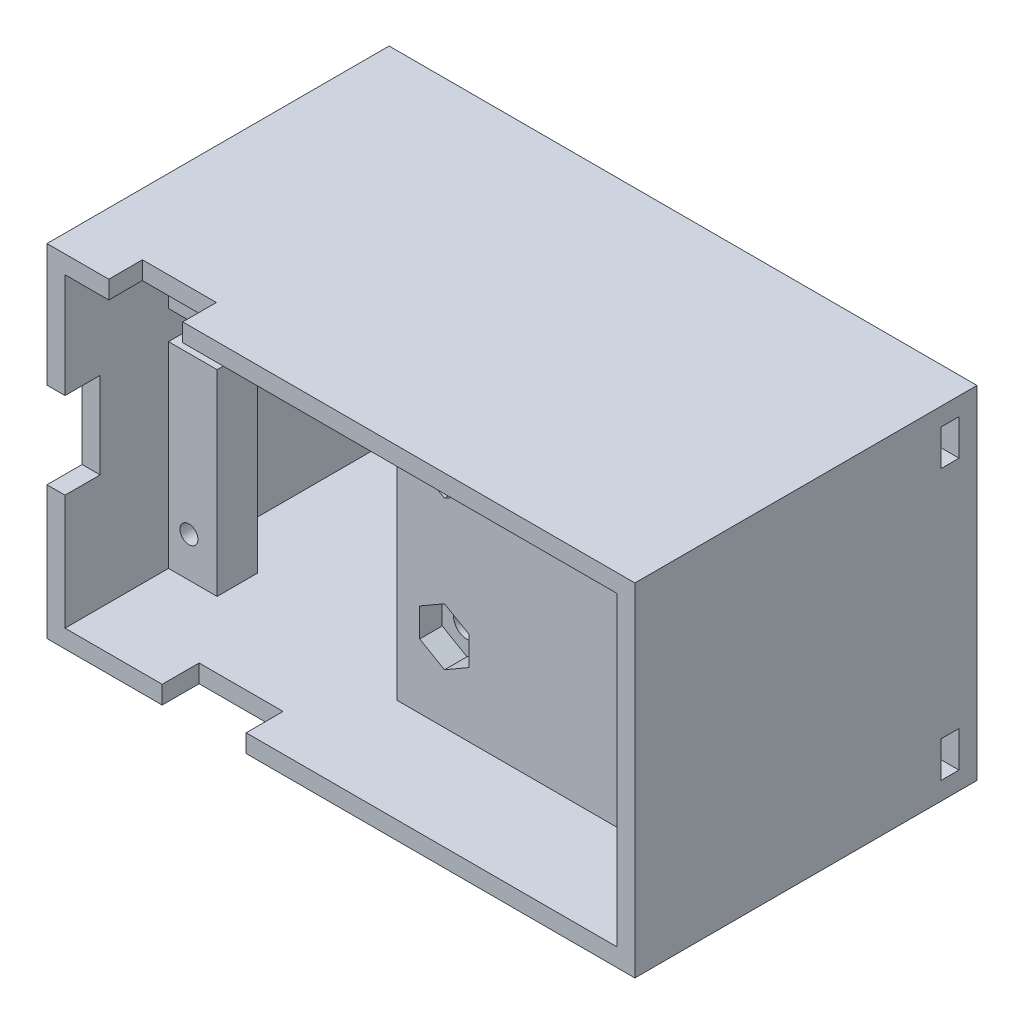
from build123d import *

# Parameters (mm, degrees)
SKETCH_2_W           = 65.2997206
SKETCH_2_H           = 38
SKETCH_2_R           = 1.00000254
SKETCH_2_R_2         = 1.5
SKETCH_2_R_3         = 0.922218434
EXTRUDE_2_DEPTH      = 4.5
CUT_EXTRUDE_2_DEPTH  = 2.5
EXTRUDE_3_DEPTH      = 22
EXTRUDE_3_DEPTH_BACK = 16
SKETCH_5_W           = 65.2997206
SKETCH_5_H           = 38
SKETCH_5_W_2         = 61.2997206
SKETCH_5_H_2         = 34
SKETCH_7_W           = 8.214112973
SKETCH_7_H           = 3.795011114
CUT_EXTRUDE_4_DEPTH  = 3
SKETCH_8_W           = 4
SKETCH_8_H           = 9.575559499
CUT_EXTRUDE_5_DEPTH  = 3
SKETCH_9_W           = 9.326303795
SKETCH_9_H           = 4.202278939
CUT_EXTRUDE_6_DEPTH  = 3
CUT_EXTRUDE_7_DEPTH  = 10
SKETCH_15_R          = 1.75
CUT_EXTRUDE_8_DEPTH  = 1.5
SKETCH_18_W          = 61.2997206
SKETCH_18_H          = 35
CUT_EXTRUDE_9_DEPTH  = 2
SKETCH_19_W          = 2
SKETCH_19_H          = 4
CUT_EXTRUDE_10_DEPTH = 2
SKETCH_20_W          = 2
SKETCH_20_H          = 6
CUT_EXTRUDE_11_DEPTH = 1.5


with BuildPart() as part:
    # 草图2 → 凸台-拉伸2 (new body)
    with BuildSketch(Plane(origin=(0, 0, -6), x_dir=(-1, 0, 0), z_dir=(0, 0, -1))):
        with Locations((29.273558547, -24.066548133)):
            Rectangle(SKETCH_2_W, SKETCH_2_H)
        with Locations((0.889001778, -36.83007366)):
            Circle(SKETCH_2_R, mode=Mode.SUBTRACT)
        with Locations((29.273558547, -32.316548133)):
            Circle(SKETCH_2_R_2, mode=Mode.SUBTRACT)
        with Locations((57.658115316, -36.64983236)):
            Circle(SKETCH_2_R, mode=Mode.SUBTRACT)
        with Locations((1.016002032, -11.24978156)):
            Circle(SKETCH_2_R, mode=Mode.SUBTRACT)
        with BuildLine():
            ThreePointArc((30.761710061, -15.816548133), (29.273558547, -17.304699647), (27.785407033, -15.816548133))
            Line((27.785407033, -15.816548133), (27.785407033, -13.183619987))
            ThreePointArc((27.785407033, -13.183619987), (29.273558547, -11.695468472), (30.761710061, -13.183619987))
            Line((30.761710061, -13.183619987), (30.761710061, -15.816548133))
        make_face(mode=Mode.SUBTRACT)
        with Locations((57.658115316, -11.24978156)):
            Circle(SKETCH_2_R_3, mode=Mode.SUBTRACT)
    extrude(amount=EXTRUDE_2_DEPTH)

    # 草图3 → 切除-拉伸2 (cut)
    with BuildSketch(Plane(origin=(0, 0, -6), x_dir=(-1, 0, 0), z_dir=(0, 0, -1))):
        Polygon((29.273558547, -18.991974614), (32.023558547, -17.404261373), (32.023558547, -14.920341582), (32.023558547, -14.228834893), (32.023558547, -11.744915102), (29.273558547, -10.157201862), (26.523558547, -11.744915102), (26.523558547, -14.228834893), (26.523558547, -14.920341582), (26.523558547, -17.404261373), align=None)
        Polygon((26.523558547, -30.728834893), (26.523558547, -33.904261373), (29.273558547, -35.491974614), (32.023558547, -33.904261373), (32.023558547, -30.728834893), (29.273558547, -29.141121653), align=None)
    extrude(amount=CUT_EXTRUDE_2_DEPTH, mode=Mode.SUBTRACT)

    # 草图5 → 凸台-拉伸3 (add, two sides: drawn at the far end of the back side and taken through both)
    with BuildSketch(Plane(origin=(0, 0, -10.5), x_dir=(-1, 0, 0), z_dir=(0, 0, -1)).offset(-EXTRUDE_3_DEPTH_BACK)):
        with Locations((29.273558547, -24.066548133)):
            Rectangle(SKETCH_5_W, SKETCH_5_H)
        with Locations((29.273558547, -24.066548133)):
            Rectangle(SKETCH_5_W_2, SKETCH_5_H_2, mode=Mode.SUBTRACT)
    extrude(amount=EXTRUDE_3_DEPTH + EXTRUDE_3_DEPTH_BACK)

    # 草图7 → 切除-拉伸4 (cut)
    with BuildSketch(Plane(origin=(0, -5.066548133, 0), x_dir=(1, 0, 0), z_dir=(0, 1, 0))):
        with Locations((-50.955145133, -3.662545243)):
            Rectangle(SKETCH_7_W, SKETCH_7_H)
    extrude(amount=-CUT_EXTRUDE_4_DEPTH, mode=Mode.SUBTRACT)

    # 草图8 → 切除-拉伸5 (cut)
    with BuildSketch(Plane.ZY.offset(61.923418847)):
        with Locations((3.6000508, -23.483057223)):
            Rectangle(SKETCH_8_W, SKETCH_8_H)
    extrude(amount=-CUT_EXTRUDE_5_DEPTH, mode=Mode.SUBTRACT)

    # 草图9 → 切除-拉伸6 (cut)
    with BuildSketch(Plane.XZ.offset(43.066548133)):
        with Locations((-44.464129124, 3.49891133)):
            Rectangle(SKETCH_9_W, SKETCH_9_H)
    extrude(amount=-CUT_EXTRUDE_6_DEPTH, mode=Mode.SUBTRACT)

    # 草图13 → 切除-拉伸7 (cut)
    with BuildSketch(Plane.XY.offset(-6)):
        Polygon((-59.923418847, -16.066514367), (-59.923418847, -19.252115931), (-54.525349934, -19.252115931), (-54.525349934, -41.066548133), (-34.525349934, -41.066548133), (-34.525349934, -7.066548133), (-54.525349934, -7.066548133), (-54.525349934, -12.880912803), (-54.525349934, -16.066514367), align=None)
    extrude(amount=-CUT_EXTRUDE_7_DEPTH, mode=Mode.SUBTRACT)

    # 草图15 → 切除-拉伸8 (cut)
    with BuildSketch(Plane(origin=(0, 0, -10.5), x_dir=(-1, 0, 0), z_dir=(0, 0, -1))):
        with Locations((1.016002032, -11.24978156)):
            Circle(SKETCH_15_R)
        with Locations((57.658115316, -11.24978156)):
            Circle(SKETCH_15_R)
        with Locations((0.889001778, -36.83007366)):
            Circle(SKETCH_15_R)
        with Locations((57.658115316, -36.64983236)):
            Circle(SKETCH_15_R)
    extrude(amount=-CUT_EXTRUDE_8_DEPTH, mode=Mode.SUBTRACT)

    # 草图18 → 切除-拉伸9 (cut)
    with BuildSketch(Plane(origin=(0, 0, -32.5), x_dir=(-1, 0, 0), z_dir=(0, 0, -1))):
        with Locations((29.273558547, -24.066548133)):
            Rectangle(SKETCH_18_W, SKETCH_18_H)
    extrude(amount=-CUT_EXTRUDE_9_DEPTH, mode=Mode.SUBTRACT)

    # 草图19 → 切除-拉伸10 (cut)
    with BuildSketch(Plane.ZY.offset(-1.376301753)):
        with Locations((-29.5, -9.066548133)):
            Rectangle(SKETCH_19_W, SKETCH_19_H)
        with Locations((-29.5, -39.066548133)):
            Rectangle(SKETCH_19_W, SKETCH_19_H)
    extrude(amount=-CUT_EXTRUDE_10_DEPTH, mode=Mode.SUBTRACT)

    # 草图20 → 切除-拉伸11 (cut)
    with BuildSketch(Plane(origin=(0, 0, -32.5), x_dir=(-1, 0, 0), z_dir=(0, 0, -1))):
        with Locations((60.923418847, -24.066548133)):
            Rectangle(SKETCH_20_W, SKETCH_20_H)
    extrude(amount=-CUT_EXTRUDE_11_DEPTH, mode=Mode.SUBTRACT)


solid = part.part
